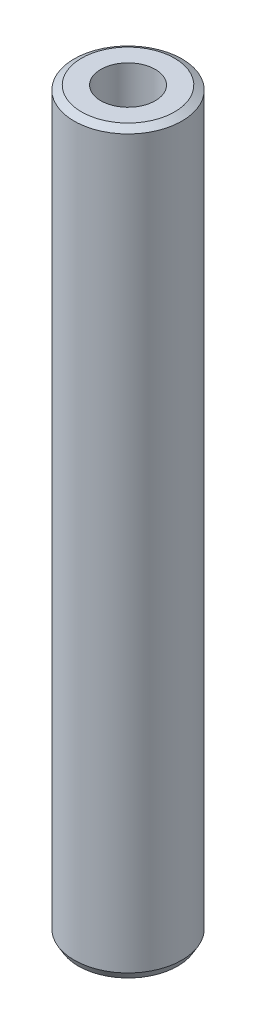
from build123d import *
from OCP.BRepFilletAPI import BRepFilletAPI_MakeChamfer

# Parameters (mm, degrees)
SKETCH1_R           = 22.5
BOSS_EXTRUDE1_DEPTH = 308.10644455
SKETCH2_R           = 11.365406333
CUT_EXTRUDE1_DEPTH  = 310.74518749
CHAMFER1_SIZE       = 1.776123678
CHAMFER1_SIZE2      = 3.076336451


with BuildPart() as part:
    # Sketch1 → Boss-Extrude1 (new body)
    with BuildSketch(Plane(origin=(0, 0, 0), x_dir=(1, 0, 0), z_dir=(0, 1, 0))):
        Circle(SKETCH1_R)
    extrude(amount=BOSS_EXTRUDE1_DEPTH)

    # Sketch2 → Cut-Extrude1 (cut, through all)
    with BuildSketch(Plane(origin=(0, 0, 0), x_dir=(1, 0, 0), z_dir=(0, 1, 0))):
        Circle(SKETCH2_R)
    extrude(amount=CUT_EXTRUDE1_DEPTH, mode=Mode.SUBTRACT)

    # Chamfer1: one chamfer whose edges measure the first distance from different faces: ONE call of the kernel's chamfer builder (chamfer() names one face for all edges)
    chamfer1_edges_1 = [part.edges().sort_by_distance(p)[0] for p in [
        (-22.5, 308.10644455, 0),
    ]]
    chamfer1_side_1 = [part.faces().sort_by_distance(p)[0] for p in [
        (-22.5, 154.053222275, 0),
    ]]
    chamfer1_edges_2 = [part.edges().sort_by_distance(p)[0] for p in [
        (-22.5, 0, 0),
    ]]
    chamfer1_side_2 = [part.faces().sort_by_distance(p)[0] for p in [
        (-21.863603897, 0, 0),
    ]]
    chamfer1 = BRepFilletAPI_MakeChamfer(part.part.solid().wrapped)
    for e in chamfer1_edges_1:
        chamfer1.Add(CHAMFER1_SIZE, CHAMFER1_SIZE2, e.wrapped, chamfer1_side_1[0].wrapped)  # the first distance lies on this face
    for e in chamfer1_edges_2:
        chamfer1.Add(CHAMFER1_SIZE, CHAMFER1_SIZE2, e.wrapped, chamfer1_side_2[0].wrapped)  # the first distance lies on this face
    add(Compound.cast(chamfer1.Shape()), mode=Mode.REPLACE)


solid = part.part
